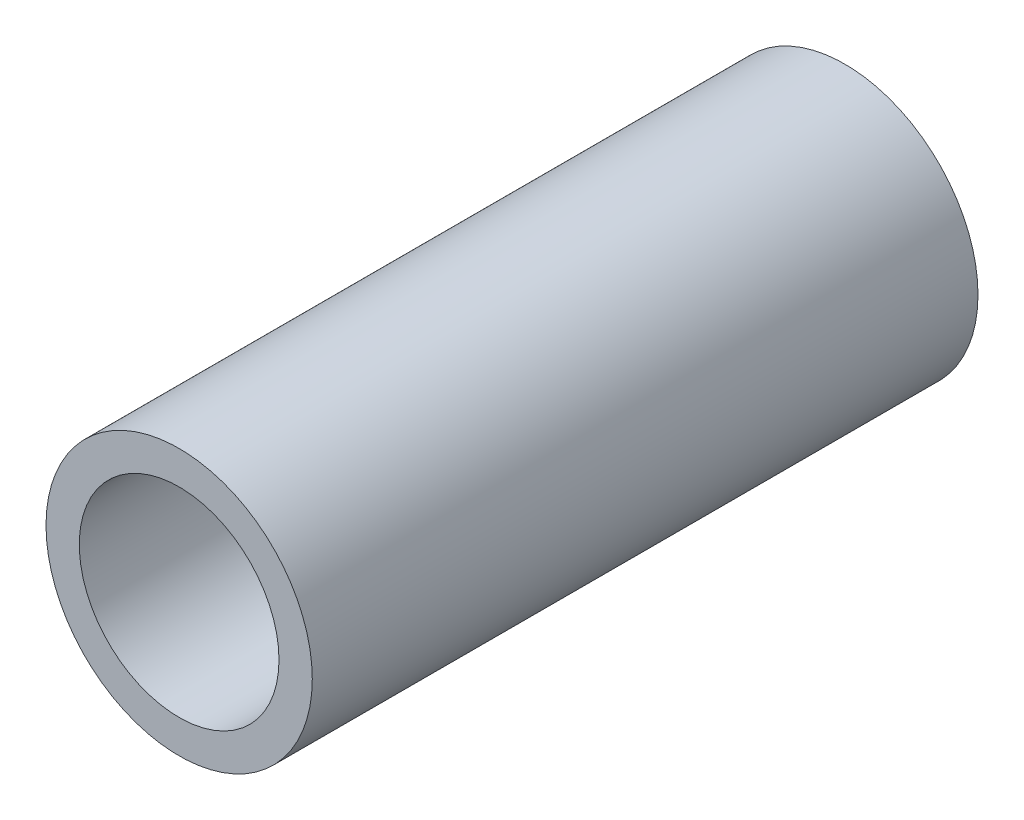
from build123d import *

# Parameters (mm, degrees)
ESQUISSE1_R             = 4
BOSS_EXTRU_1_DEPTH      = 20
ESQUISSE2_R             = 3
ENL_V_MAT_EXTRU_1_DEPTH = 5


with BuildPart() as part:
    # Esquisse1 → Boss.-Extru.1 (new body)
    with BuildSketch(Plane.XY):
        Circle(ESQUISSE1_R)
    extrude(amount=BOSS_EXTRU_1_DEPTH)

    # Esquisse2 → Enlèv. mat.-Extru.1 (cut)
    with BuildSketch(Plane.XY.offset(20)):
        Circle(ESQUISSE2_R)
    extrude(amount=-ENL_V_MAT_EXTRU_1_DEPTH, mode=Mode.SUBTRACT)


solid = part.part
